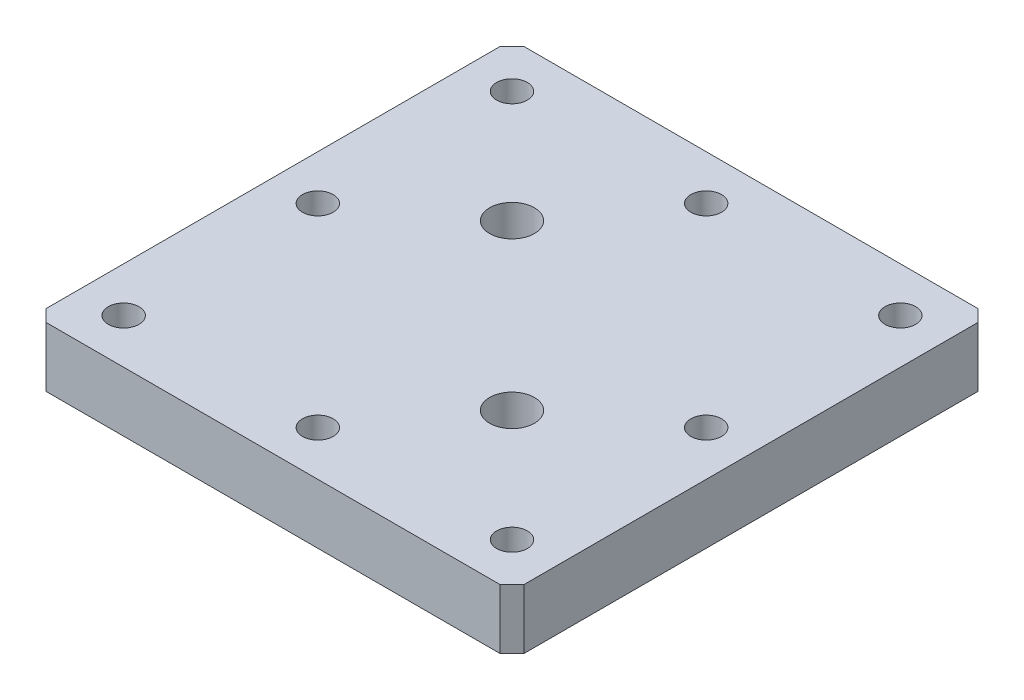
from build123d import *

# Parameters (mm, degrees)
SKETCH1_R               = 3.2639
BOSS_EXTRUDE1_DEPTH     = 12.7
CUT_EXTRUDE5_DEPTH      = 73.955945611
CUT_EXTRUDE5_DEPTH_BACK = 73.955945611
SKETCH1_4_R             = 4.7625


with BuildPart() as part:
    # Sketch1 → Boss-Extrude1 (new body)
    with BuildSketch(Plane(origin=(0, 0, 0), x_dir=(1, 0, 0), z_dir=(0, 1, 0))):
        Polygon((-48.26, 50.8), (-50.8, 48.26), (-50.8, -48.26), (-48.26, -50.8), (48.26, -50.8), (50.8, -48.26), (50.8, 48.26), (48.26, 50.8), align=None)
        with Locations((-41.275, -41.275)):
            Circle(SKETCH1_R, mode=Mode.SUBTRACT)
        with Locations((0, -41.275)):
            Circle(SKETCH1_R, mode=Mode.SUBTRACT)
        with Locations((-41.275, 0)):
            Circle(SKETCH1_R, mode=Mode.SUBTRACT)
        with Locations((41.275, -41.275)):
            Circle(SKETCH1_R, mode=Mode.SUBTRACT)
        with Locations((-41.275, 41.275)):
            Circle(SKETCH1_R, mode=Mode.SUBTRACT)
        with Locations((0, 41.275)):
            Circle(SKETCH1_R, mode=Mode.SUBTRACT)
        with Locations((41.275, 0)):
            Circle(SKETCH1_R, mode=Mode.SUBTRACT)
        with Locations((41.275, 41.275)):
            Circle(SKETCH1_R, mode=Mode.SUBTRACT)
    extrude(amount=BOSS_EXTRUDE1_DEPTH)

    # Sketch1<4> → Cut-Extrude5 (cut, two sides: drawn at the far end of the back side and taken through both)
    with BuildSketch(Plane(origin=(0, 0, 0), x_dir=(1, 0, 0), z_dir=(0, 1, 0)).offset(-CUT_EXTRUDE5_DEPTH_BACK)):
        with Locations((-17.4625, 17.4625)):
            Circle(SKETCH1_4_R)
        with Locations((17.4625, -17.4625)):
            Circle(SKETCH1_4_R)
    extrude(amount=CUT_EXTRUDE5_DEPTH + CUT_EXTRUDE5_DEPTH_BACK, mode=Mode.SUBTRACT)


solid = part.part
